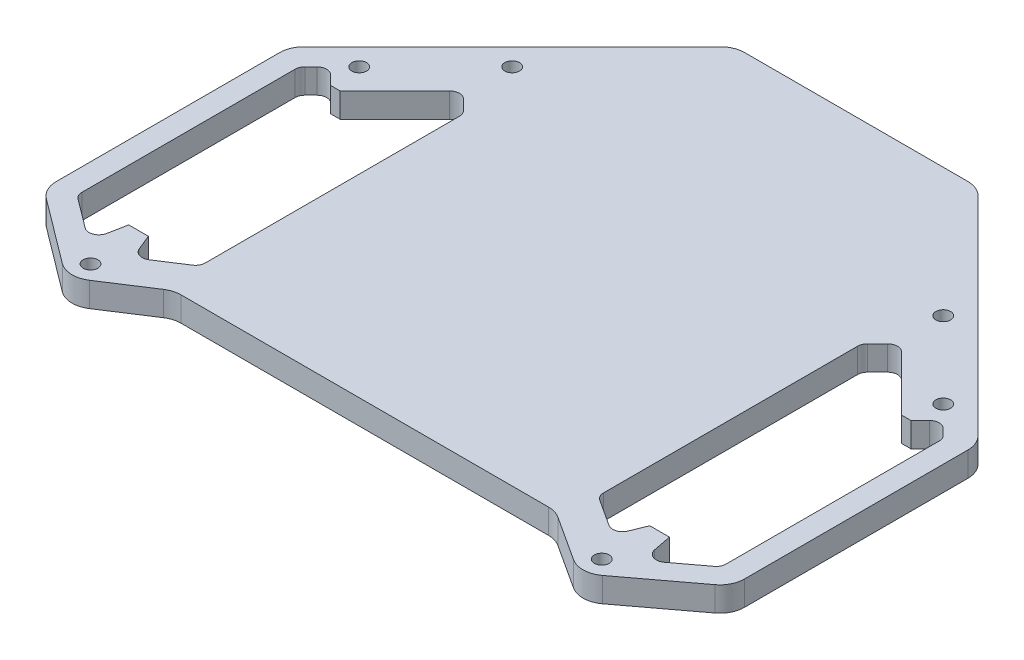
from build123d import *

# Parameters (mm, degrees)
SKETCH1_R            = 1.5
BOSS_EXTRUDE1_DEPTH  = 5
FILLET1_R            = 2
FILLET1_OF_MIRROR1_R = 2
SKETCH2_W            = 70
SKETCH2_H            = 97
CUT_EXTRUDE1_DEPTH   = 3
FILLET2_R            = 5


with BuildPart() as part:
    # Sketch1 → Boss-Extrude1 (new body)
    with BuildSketch(Plane(origin=(0, 0, 0), x_dir=(1, 0, 0), z_dir=(0, 1, 0))):
        Polygon((-52.164149312, -38.645247828), (-70, -25.247940817), (-70, 24.752308679), (-24.752308679, 70), (0, 70), (0, -30), (-38.851635079, -30), align=None)
        with Locations((-43.840620434, 43.840620434)):
            Circle(SKETCH1_R, mode=Mode.SUBTRACT)
        with Locations((-51.997575213, -33.767620171)):
            Circle(SKETCH1_R, mode=Mode.SUBTRACT)
        with Locations((-59.39696962, 28.284271247)):
            Circle(SKETCH1_R, mode=Mode.SUBTRACT)
        Polygon((-59.003765723, 22.1), (-57.095959493, 22.1), (-44.547727215, 34.648232278), (-40.5, 30.600505063), (-40.5, -23), (-48.796166422, -28.387593469), (-51, -23), (-55, -23), (-56.33662338, -29.883022962), (-65.5, -23), (-65.5, 22.181240867), (-62.292503295, 25.388737572), align=None, mode=Mode.SUBTRACT)
    boss_extrude1 = extrude(amount=BOSS_EXTRUDE1_DEPTH)

    # Fillet1
    fillet1_edges = [part.edges().sort_by_distance(p)[0] for p in [
        (-40.5, 2.5, 23),
        (-48.796166422, 2.5, 28.387593469),
        (-56.33662338, 2.5, 29.883022962),
        (-65.5, 2.5, 23),
        (-65.5, 2.5, -22.181240867),
        (-62.292503295, 2.5, -25.388737572),
        (-40.5, 2.5, -30.600505063),
        (-44.547727215, 2.5, -34.648232278),
    ]]
    fillet(fillet1_edges, radius=FILLET1_R)

    # Mirror1: Boss-Extrude1 across plane
    add(boss_extrude1.mirror(Plane(origin=(0, 5, 30), x_dir=(0, 0, 1), z_dir=(-1, 0, 0))))

    # Fillet1 of Mirror1
    fillet1_of_mirror1_edges = [part.edges().sort_by_distance(p)[0] for p in [
        (40.5, 2.5, 23),
        (48.796166422, 2.5, 28.387593469),
        (56.33662338, 2.5, 29.883022962),
        (65.5, 2.5, 23),
        (65.5, 2.5, -22.181240867),
        (62.292503295, 2.5, -25.388737572),
        (40.5, 2.5, -30.600505063),
        (44.547727215, 2.5, -34.648232278),
    ]]
    fillet(fillet1_of_mirror1_edges, radius=FILLET1_OF_MIRROR1_R)

    # Sketch2 → Cut-Extrude1 (cut)
    with BuildSketch(Plane(origin=(0, 0, 0), x_dir=(1, 0, 0), z_dir=(0, 1, 0))):
        with Locations((0, 21.5)):
            Rectangle(SKETCH2_W, SKETCH2_H)
    extrude(amount=CUT_EXTRUDE1_DEPTH, mode=Mode.SUBTRACT)

    # Fillet2
    fillet2_edges = [part.edges().sort_by_distance(p)[0] for p in [
        (-70, 2.5, 25.247940817),
        (-70, 2.5, -24.752308679),
        (-24.752308679, 4, -70),
        (24.752308679, 4, -70),
        (70, 2.5, -24.752308679),
        (70, 2.5, 25.247940817),
        (38.851635079, 2.5, 30),
        (52.164149312, 2.5, 38.645247828),
        (-38.851635079, 2.5, 30),
        (-52.164149312, 2.5, 38.645247828),
    ]]
    fillet(fillet2_edges, radius=FILLET2_R)


solid = part.part
